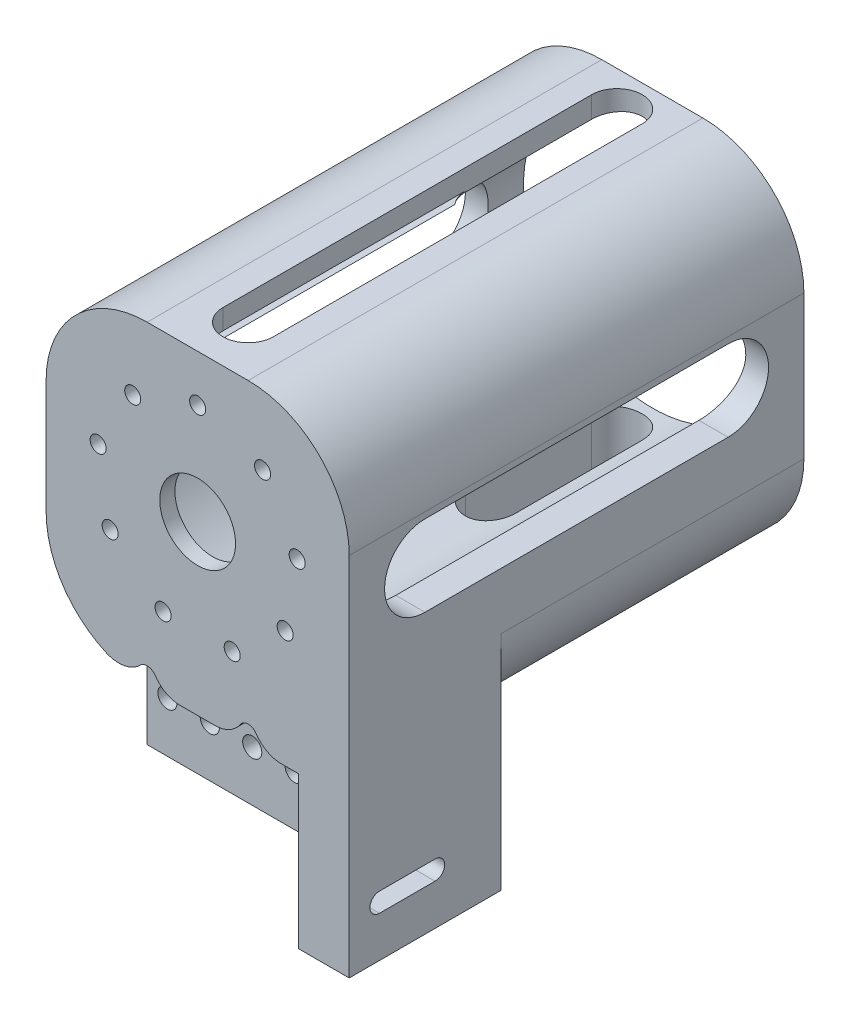
from build123d import *

# Parameters (mm, degrees)
SKETCH1_W           = 76.2
SKETCH1_H           = 117.383180995
SKETCH1_R           = 9.525
BOSS_EXTRUDE1_DEPTH = 3.81
SKETCH2_W           = 76.2
SKETCH2_H           = 117.383180995
SKETCH2_R           = 32.385
BOSS_EXTRUDE2_DEPTH = 34.29
SKETCH3_W           = 76.2
SKETCH3_H           = 86.903180995
SKETCH3_R           = 32.385
BOSS_EXTRUDE3_DEPTH = 76.2
FILLET2_R           = 25.4
SKETCH4_W           = 63.5
SKETCH4_H           = 25.4
CUT_EXTRUDE1_DEPTH  = 38.1
FILLET3_R           = 25.4
SKETCH5_R           = 2.413
CUT_EXTRUDE2_DEPTH  = 145.770196159
FILLET4_R           = 7.62
SKETCH6_R           = 2.413
CUT_EXTRUDE3_DEPTH  = 118.048535642
CUT_EXTRUDE4_DEPTH  = 157.386667578
SKETCH8_W           = 25.4
SKETCH8_H           = 5.08
BOSS_EXTRUDE4_DEPTH = 5.08
FILLET5_R           = 5.08
CUT_EXTRUDE7_DEPTH  = 157.386667697
CUT_EXTRUDE8_DEPTH  = 146.642758133
CUT_EXTRUDE9_START  = -5.08
CUT_EXTRUDE9_DEPTH  = 5.08
SKETCH12_R          = 2.0193
CUT_EXTRUDE10_DEPTH = 5.08
CUT_EXTRUDE12_START = -101.6
CUT_EXTRUDE12_DEPTH = 101.6


# Some blends are built 0.0001 mm under size
with BuildPart() as part:
    # Sketch1 → Boss-Extrude1 (new body)
    with BuildSketch(Plane.XY):
        with Locations((0, -21.572409503)):
            Rectangle(SKETCH1_W, SKETCH1_H)
        with Locations(Location((0, 0, 0), (0, 0, 180))):
            Circle(SKETCH1_R, mode=Mode.SUBTRACT)
    extrude(amount=BOSS_EXTRUDE1_DEPTH)

    # Sketch2 → Boss-Extrude2 (add)
    with BuildSketch(Plane(origin=(0, 0, 0), x_dir=(-1, 0, 0), z_dir=(0, 0, -1))):
        with Locations((0, -21.572409503)):
            Rectangle(SKETCH2_W, SKETCH2_H)
        Circle(SKETCH2_R, mode=Mode.SUBTRACT)
    extrude(amount=BOSS_EXTRUDE2_DEPTH)

    # Sketch3 → Boss-Extrude3 (add)
    with BuildSketch(Plane(origin=(0, 0, -34.29), x_dir=(-1, 0, 0), z_dir=(0, 0, -1))):
        with Locations((0, -6.332409503)):
            Rectangle(SKETCH3_W, SKETCH3_H)
        Circle(SKETCH3_R, mode=Mode.SUBTRACT)
    extrude(amount=BOSS_EXTRUDE3_DEPTH)

    # Fillet2
    fillet2_edges = [part.edges().sort_by_distance(p)[0] for p in [
        (-38.1, -49.784, -72.39),
        (38.1, -49.784, -72.39),
        (38.1, 37.119180995, -53.34),
        (-38.1, 37.119180995, -53.34),
    ]]
    fillet(fillet2_edges, radius=FILLET2_R)

    # Sketch4 → Cut-Extrude1 (cut)
    with BuildSketch(Plane(origin=(0, -80.264, 0), x_dir=(-1, 0, 0), z_dir=(0, -1, 0))):
        with Locations((6.35, 8.89)):
            Rectangle(SKETCH4_W, SKETCH4_H)
    extrude(amount=-CUT_EXTRUDE1_DEPTH, mode=Mode.SUBTRACT)

    # Fillet3
    fillet3_edges = [part.edges().sort_by_distance(p)[0] for p in [
        (-38.1, -42.164, -8.89),
    ]]
    fillet(fillet3_edges, radius=FILLET3_R)

    # Sketch5 → Cut-Extrude2 (cut, through all)
    with BuildSketch(Plane(origin=(0, 0, -110.49), x_dir=(-1, 0, 0), z_dir=(0, 0, -1))):
        with Locations((-12.7, -40.103047141)):
            Circle(SKETCH5_R)
        with Locations((12.7, -40.103047141)):
            Circle(SKETCH5_R)
    extrude(amount=-CUT_EXTRUDE2_DEPTH, mode=Mode.SUBTRACT)

    # Fillet4
    # the kernel refuses this fillet: 7.62 mm, written as the material it takes off along each edge
    with BuildSketch(Plane(origin=(13.955006897, -42.164, 21.552809007), x_dir=(1, 0, 0), z_dir=(0, 0, -1))) as fillet4_piece_1:
        with BuildLine():
            CenterArc((7.097123603, -7.62), FILLET4_R, 90, 56.352886424)
            ThreePointArc((0.75373335, -3.397938881), (1.100732586, -1.538400961), (0, 0))
            Line((0, 0), (7.097123603, 0))
        make_face()
    extrude(amount=43.142809007, mode=Mode.SUBTRACT)
    with BuildSketch(Plane(origin=(11.444993103, -42.164, 21.552809007), x_dir=(-0.2165569408364877, 0.9762699889761756, 0), z_dir=(0, 0, -1))) as fillet4_piece_2:
        with BuildLine():
            CenterArc((8.976108692, -5.278544892), FILLET4_R, 136.153999219, 56.352886424)
            Line((1.536931376, -6.928708782), (0, 0))
            ThreePointArc((0, 0), (1.740265971, -0.741460784), (3.480531942, 0))
        make_face()
    extrude(amount=43.142809007, mode=Mode.SUBTRACT)
    with BuildSketch(Plane(origin=(-14.008811576, -42.130257356, -21.59), x_dir=(-0.9731528200904738, 0.2301599199468886, 0), z_dir=(0, 0, 1))) as fillet4_piece_3:
        with BuildLine():
            CenterArc((7.759857546, -7.495944255), FILLET4_R, 79.647158733, 68.988740546)
            ThreePointArc((1.253314244, -3.529926825), (1.466832767, -1.466655783), (0, 0))
            ThreePointArc((0, 0), (4.564622086, 0.413519151), (9.129244172, 0))
        make_face()
    extrude(amount=48.22311043, mode=Mode.SUBTRACT)
    with BuildSketch(Plane(origin=(-11.444993103, -42.164, 21.552809007), x_dir=(0.21655694083648722, 0.9762699889761757, 0), z_dir=(0, 0, -1))) as fillet4_piece_4:
        with BuildLine():
            CenterArc((8.976108692, 5.278544892), FILLET4_R, 167.493114357, 56.352886424)
            Line((1.536931376, 6.928708782), (0, 0))
            ThreePointArc((0, 0), (1.740265971, 0.741460784), (3.480531942, 0))
        make_face()
    extrude(amount=43.142809007, mode=Mode.SUBTRACT)

    # Sketch6 → Cut-Extrude3 (cut, through all)
    with BuildSketch(Plane(origin=(0, 0, -34.29), x_dir=(-1, 0, 0), z_dir=(0, 0, -1))):
        with Locations((33.02, -67.564)):
            Circle(SKETCH6_R)
        with Locations((22.352, -67.564)):
            Circle(SKETCH6_R)
        with Locations((11.684, -67.564)):
            Circle(SKETCH6_R)
        with Locations((1.016, -67.564)):
            Circle(SKETCH6_R)
        with Locations((-9.652, -67.564)):
            Circle(SKETCH6_R)
        with Locations((-20.32, -67.564)):
            Circle(SKETCH6_R)
    extrude(amount=-CUT_EXTRUDE3_DEPTH, mode=Mode.SUBTRACT)

    # Sketch7 → Cut-Extrude4 (cut, through all)
    with BuildSketch(Plane(origin=(38.1, 0, 0), x_dir=(0, 0, -1), z_dir=(1, 0, 0))):
        with BuildLine():
            Line((15.24, 10.16), (91.44, 10.16))
            ThreePointArc((91.44, 10.16), (101.6, 0), (91.44, -10.16))
            Line((91.44, -10.16), (15.24, -10.16))
            ThreePointArc((15.24, -10.16), (5.08, 0), (15.24, 10.16))
        make_face()
    extrude(amount=-CUT_EXTRUDE4_DEPTH, mode=Mode.SUBTRACT)

    # Sketch8 → Boss-Extrude4 (add)
    with BuildSketch(Plane(origin=(0, -49.784, 0), x_dir=(-1, 0, 0), z_dir=(0, -1, 0))):
        with Locations((0, 55.88)):
            Rectangle(SKETCH8_W, SKETCH8_H)
    extrude(amount=BOSS_EXTRUDE4_DEPTH)

    # Fillet5
    fillet5_edges = [part.edges().sort_by_distance(p)[0] for p in [
        (0, -49.784, -58.42),
        (0, -49.784, -53.34),
    ]]
    fillet(fillet5_edges, radius=FILLET5_R - 0.0001)  # a hair under: the kernel refuses the full size

    # Sketch9 → Cut-Extrude7 (cut, through all)
    with BuildSketch(Plane(origin=(38.1, 0, 0), x_dir=(0, 0, -1), z_dir=(1, 0, 0))):
        with BuildLine():
            Line((3.81, -65.151), (17.78, -65.151))
            ThreePointArc((17.78, -65.151), (20.193, -67.564), (17.78, -69.977))
            Line((17.78, -69.977), (3.81, -69.977))
            ThreePointArc((3.81, -69.977), (1.397, -67.564), (3.81, -65.151))
        make_face()
    extrude(amount=-CUT_EXTRUDE7_DEPTH, mode=Mode.SUBTRACT)

    # Sketch10 → Cut-Extrude8 (cut, through all)
    with BuildSketch(Plane.XZ.offset(49.784)):
        with BuildLine():
            Line((-6.35, -101.6), (-6.35, -69.85))
            ThreePointArc((-6.35, -69.85), (0, -63.5), (6.35, -69.85))
            Line((6.35, -69.85), (6.35, -101.6))
            ThreePointArc((6.35, -101.6), (0, -107.95), (-6.35, -101.6))
        make_face()
    extrude(amount=-CUT_EXTRUDE8_DEPTH, mode=Mode.SUBTRACT)

    # Sketch11 → Cut-Extrude9 (cut)
    with BuildSketch(Plane(origin=(0, 37.119180995, 0), x_dir=(1, 0, 0), z_dir=(0, 1, 0)).offset(CUT_EXTRUDE9_START)):
        with BuildLine():
            Line((-6.35, 8.89), (-6.35, 101.6))
            ThreePointArc((-6.35, 101.6), (0, 107.95), (6.35, 101.6))
            Line((6.35, 101.6), (6.35, 8.89))
            ThreePointArc((6.35, 8.89), (0, 2.54), (-6.35, 8.89))
        make_face()
    extrude(amount=CUT_EXTRUDE9_DEPTH, mode=Mode.SUBTRACT)

    # Sketch12 → Cut-Extrude10 (cut)
    with BuildSketch(Plane.XY.offset(3.81)):
        with Locations((0, 25.4)):
            Circle(SKETCH12_R)
        with Locations((16.326805286, 19.457528855)):
            Circle(SKETCH12_R)
        with Locations((25.014116927, 4.410663713)):
            Circle(SKETCH12_R)
        with Locations((21.997045256, -12.7)):
            Circle(SKETCH12_R)
        with Locations((8.68731164, -23.868192568)):
            Circle(SKETCH12_R)
        with Locations((-8.68731164, -23.868192568)):
            Circle(SKETCH12_R)
        with Locations((-21.997045256, -12.7)):
            Circle(SKETCH12_R)
        with Locations((-25.014116927, 4.410663713)):
            Circle(SKETCH12_R)
        with Locations((-16.326805286, 19.457528855)):
            Circle(SKETCH12_R)
    extrude(amount=-CUT_EXTRUDE10_DEPTH, mode=Mode.SUBTRACT)

    # Sketch13 → Cut-Extrude12 (cut)
    with BuildSketch(Plane(origin=(0, 0, -110.49), x_dir=(-1, 0, 0), z_dir=(0, 0, -1)).offset(CUT_EXTRUDE12_START)):
        with BuildLine():
            Line((-31.75, 17.378593873), (-28.407894737, 15.549268202))
            ThreePointArc((-28.407894737, 15.549268202), (-22.899653109, 22.899653109), (-15.549268202, 28.407894737))
            Line((-15.549268202, 28.407894737), (-17.378593873, 31.75))
            ThreePointArc((-17.378593873, 31.75), (-25.593729945, 25.593729945), (-31.75, 17.378593873))
        make_face()
        with BuildLine():
            Line((17.378593873, 31.75), (15.549268202, 28.407894737))
            ThreePointArc((15.549268202, 28.407894737), (22.899653109, 22.899653109), (28.407894737, 15.549268202))
            Line((28.407894737, 15.549268202), (31.75, 17.378593873))
            ThreePointArc((31.75, 17.378593873), (25.593729945, 25.593729945), (17.378593873, 31.75))
        make_face()
        with BuildLine():
            Line((31.75, -17.378593873), (28.407894737, -15.549268202))
            ThreePointArc((28.407894737, -15.549268202), (22.899653109, -22.899653109), (15.549268202, -28.407894737))
            Line((15.549268202, -28.407894737), (17.378593873, -31.75))
            ThreePointArc((17.378593873, -31.75), (25.593729945, -25.593729945), (31.75, -17.378593873))
        make_face()
        with BuildLine():
            Line((-17.378593873, -31.75), (-15.549268202, -28.407894737))
            ThreePointArc((-15.549268202, -28.407894737), (-22.899653109, -22.899653109), (-28.407894737, -15.549268202))
            Line((-28.407894737, -15.549268202), (-31.75, -17.378593873))
            ThreePointArc((-31.75, -17.378593873), (-25.593729945, -25.593729945), (-17.378593873, -31.75))
        make_face()
    extrude(amount=CUT_EXTRUDE12_DEPTH, mode=Mode.SUBTRACT)


solid = part.part
